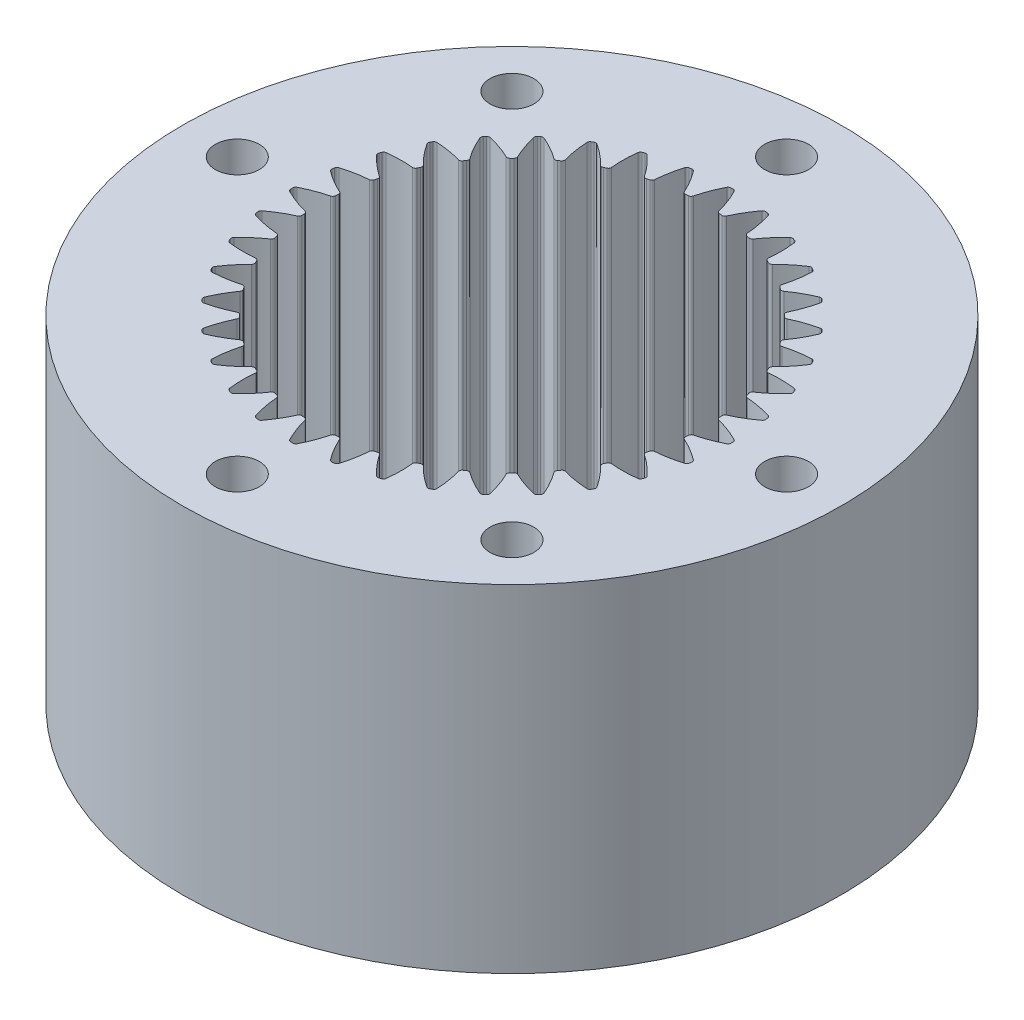
from build123d import *

# Parameters (mm, degrees)
SKETCH2_R            = 22.5
BOSS_EXTRUDE1_DEPTH  = 23
SKETCH3_R            = 13.15
CUT_EXTRUDE1_DEPTH   = 30
CUT_EXTRUDE2_DEPTH   = 23
FILLET1_R            = 0.2
FILLET1_OF_MIRROR2_R = 0.2
CIRPATTERN6_DEPTH    = 23
SKETCH5_R            = 1.5
CUT_EXTRUDE3_DEPTH   = 34


# Read off the part's stored shape, not the designer's step: CirPattern6
with BuildPart() as part:
    # Sketch2 → Boss-Extrude1 (new body)
    with BuildSketch(Plane(origin=(0, 0, 0), x_dir=(1, 0, 0), z_dir=(0, 1, 0))):
        with Locations(Location((0, 0, 0), (0, 0, 270))):
            Circle(SKETCH2_R)
    extrude(amount=BOSS_EXTRUDE1_DEPTH)

    # Sketch3 → Cut-Extrude1 (cut)
    with BuildSketch(Plane(origin=(0, 23, 0), x_dir=(1, 0, 0), z_dir=(0, 1, 0))):
        with Locations(Location((0, 0, 0), (0, 0, 270))):
            Circle(SKETCH3_R)
    extrude(amount=-CUT_EXTRUDE1_DEPTH, mode=Mode.SUBTRACT)

    # Sketch4 → Cut-Extrude2 (cut)
    with BuildSketch(Plane(origin=(0, 23, 0), x_dir=(1, 0, 0), z_dir=(0, 1, 0))):
        with BuildLine():
            Line((0, 13.11), (0, 15.025))
            ThreePointArc((0, 15.025), (0.096895427, 15.02468756), (0.193786824, 15.023750253))
            ThreePointArc((0.193786824, 15.023750253), (0.621983825, 14.074691281), (0.921652068, 13.077563132))
            ThreePointArc((0.921652068, 13.077563132), (0.461111344, 13.101888273), (0, 13.11))
        make_face()
    cut_extrude2 = extrude(amount=-CUT_EXTRUDE2_DEPTH, mode=Mode.SUBTRACT)

    # Fillet1
    fillet1_edges = [part.edges().sort_by_distance(p)[0] for p in [
        (0.912166064, 11.5, -13.118325086),
        (0.193786824, 11.5, -15.023750253),
    ]]
    fillet(fillet1_edges, radius=FILLET1_R)

    # Mirror2: Cut-Extrude2 across plane
    add(cut_extrude2.mirror(Plane(origin=(0, 0, 0), x_dir=(0, 0, 1), z_dir=(1, 0, 0))), mode=Mode.SUBTRACT)

    # Fillet1 of Mirror2
    fillet1_of_mirror2_edges = [part.edges().sort_by_distance(p)[0] for p in [
        (-0.912166064, 11.5, -13.118325086),
        (-0.193786824, 11.5, -15.023750253),
    ]]
    fillet(fillet1_of_mirror2_edges, radius=FILLET1_OF_MIRROR2_R)

    # CirPattern6 outline → CirPattern6 (cut)
    with BuildSketch(Plane(origin=(0, 0, 0), x_dir=(1, 0, 0), z_dir=(0, 1, 0))):
        with BuildLine():
            ThreePointArc((-2.343895924, 14.73300193), (-2.429782385, 14.798153838), (-2.537010614, 14.809260689))
            ThreePointArc((-2.537010614, 14.809260689), (-2.60906387, 14.796736489), (-2.681055311, 14.783861722))
            ThreePointArc((-2.681055311, 14.783861722), (-2.77801812, 14.736750482), (-2.836441728, 14.646152815))
            ThreePointArc((-2.836441728, 14.646152815), (-3.050701384, 13.784201245), (-3.166852541, 12.903646524))
            ThreePointArc((-3.166852541, 12.903646524), (-3.212731829, 12.790475649), (-3.315860377, 12.725076423))
            ThreePointArc((-3.315860377, 12.725076423), (-2.283473536, 12.950221953), (-1.236342934, 13.091751455))
            ThreePointArc((-1.236342934, 13.091751455), (-1.355619922, 13.117934584), (-1.43743907, 13.20858878))
            ThreePointArc((-1.43743907, 13.20858878), (-1.847752907, 13.996313519), (-2.343895924, 14.73300193))
        make_face()
        with BuildLine():
            ThreePointArc((1.236342934, 13.091751455), (2.283473536, 12.950221953), (3.315860377, 12.725076423))
            ThreePointArc((3.315860377, 12.725076423), (3.212731829, 12.790475649), (3.166852541, 12.903646524))
            ThreePointArc((3.166852541, 12.903646524), (3.050701384, 13.784201245), (2.836441728, 14.646152815))
            ThreePointArc((2.836441728, 14.646152815), (2.77801812, 14.736750482), (2.681055311, 14.783861722))
            ThreePointArc((2.681055311, 14.783861722), (2.60906387, 14.796736489), (2.537010614, 14.809260689))
            ThreePointArc((2.537010614, 14.809260689), (2.429782385, 14.798153838), (2.343895924, 14.73300193))
            ThreePointArc((2.343895924, 14.73300193), (1.847752907, 13.996313519), (1.43743907, 13.20858878))
            ThreePointArc((1.43743907, 13.20858878), (1.355619922, 13.117934584), (1.236342934, 13.091751455))
        make_face()
        with BuildLine():
            ThreePointArc((3.49091889, 12.678169636), (4.497564885, 12.356957964), (5.475171338, 11.955960807))
            ThreePointArc((5.475171338, 11.955960807), (5.384966001, 12.038274556), (5.359435639, 12.157692966))
            ThreePointArc((5.359435639, 12.157692966), (5.397955802, 13.045039519), (5.336627551, 13.931101907))
            ThreePointArc((5.336627551, 13.931101907), (5.294823648, 14.030468345), (5.207514703, 14.093701275))
            ThreePointArc((5.207514703, 14.093701275), (5.138852653, 14.118881627), (5.070068853, 14.143727473))
            ThreePointArc((5.070068853, 14.143727473), (4.962540977, 14.151409347), (4.866645815, 14.10216127))
            ThreePointArc((4.866645815, 14.10216127), (4.250115725, 13.462819142), (3.709248512, 12.758311962))
            ThreePointArc((3.709248512, 12.758311962), (3.612930445, 12.683242753), (3.49091889, 12.678169636))
        make_face()
        with BuildLine():
            ThreePointArc((5.639425041, 11.879368048), (6.575, 11.38823406), (7.468121989, 10.823569373))
            ThreePointArc((7.468121989, 10.823569373), (7.393580707, 10.920296583), (7.389174997, 11.04233406))
            ThreePointArc((7.389174997, 11.04233406), (7.581196065, 11.909510869), (7.674662646, 12.792761517))
            ThreePointArc((7.674662646, 12.792761517), (7.65074864, 12.897877527), (7.575746396, 12.975310845))
            ThreePointArc((7.575746396, 12.975310845), (7.5125, 13.012031692), (7.449075616, 13.048444255))
            ThreePointArc((7.449075616, 13.048444255), (7.344515273, 13.074681444), (7.241525135, 13.042833576))
            ThreePointArc((7.241525135, 13.042833576), (6.523340927, 12.520263818), (5.868354314, 11.920380291))
            ThreePointArc((5.868354314, 11.920380291), (5.760463904, 11.863177008), (5.639425041, 11.879368048))
        make_face()
        with BuildLine():
            ThreePointArc((7.616580117, 10.719617873), (8.452657068, 10.073484427), (9.234157533, 9.362309259))
            ThreePointArc((9.234157533, 9.362309259), (9.177545204, 9.470510924), (9.194398012, 9.591459421))
            ThreePointArc((9.194398012, 9.591459421), (9.534085521, 10.412117758), (9.779507001, 11.265719542))
            ThreePointArc((9.779507001, 11.265719542), (9.774209505, 11.373391227), (9.713792869, 11.462672162))
            ThreePointArc((9.713792869, 11.462672162), (9.657883836, 11.509817758), (9.601745986, 11.556690661))
            ThreePointArc((9.601745986, 11.556690661), (9.50333019, 11.600685961), (9.396374379, 11.587205983))
            ThreePointArc((9.396374379, 11.587205983), (8.598357717, 11.197286613), (7.849153141, 10.720253897))
            ThreePointArc((7.849153141, 10.720253897), (7.732968583, 10.682654634), (7.616580117, 10.719617873))
        make_face()
        with BuildLine():
            ThreePointArc((9.362309259, 9.234157533), (10.073484427, 8.452657068), (10.719617873, 7.616580117))
            ThreePointArc((10.719617873, 7.616580117), (10.682654634, 7.732968583), (10.720253897, 7.849153141))
            ThreePointArc((10.720253897, 7.849153141), (11.197286613, 8.598357717), (11.587205983, 9.396374379))
            ThreePointArc((11.587205983, 9.396374379), (11.600685961, 9.50333019), (11.556690661, 9.601745986))
            ThreePointArc((11.556690661, 9.601745986), (11.509817758, 9.657883836), (11.462672162, 9.713792869))
            ThreePointArc((11.462672162, 9.713792869), (11.373391227, 9.774209505), (11.265719542, 9.779507001))
            ThreePointArc((11.265719542, 9.779507001), (10.412117758, 9.534085521), (9.591459421, 9.194398012))
            ThreePointArc((9.591459421, 9.194398012), (9.470510924, 9.177545204), (9.362309259, 9.234157533))
        make_face()
        with BuildLine():
            ThreePointArc((10.823569373, 7.468121989), (11.38823406, 6.575), (11.879368048, 5.639425041))
            ThreePointArc((11.879368048, 5.639425041), (11.863177008, 5.760463904), (11.920380291, 5.868354314))
            ThreePointArc((11.920380291, 5.868354314), (12.520263818, 6.523340927), (13.042833576, 7.241525135))
            ThreePointArc((13.042833576, 7.241525135), (13.074681444, 7.344515273), (13.048444255, 7.449075616))
            ThreePointArc((13.048444255, 7.449075616), (13.012031692, 7.5125), (12.975310845, 7.575746396))
            ThreePointArc((12.975310845, 7.575746396), (12.897877527, 7.65074864), (12.792761517, 7.674662646))
            ThreePointArc((12.792761517, 7.674662646), (11.909510869, 7.581196065), (11.04233406, 7.389174997))
            ThreePointArc((11.04233406, 7.389174997), (10.920296583, 7.393580707), (10.823569373, 7.468121989))
        make_face()
        with BuildLine():
            ThreePointArc((11.955960807, 5.475171338), (12.356957964, 4.497564885), (12.678169636, 3.49091889))
            ThreePointArc((12.678169636, 3.49091889), (12.683242753, 3.612930445), (12.758311962, 3.709248512))
            ThreePointArc((12.758311962, 3.709248512), (13.462819142, 4.250115725), (14.10216127, 4.866645815))
            ThreePointArc((14.10216127, 4.866645815), (14.151409347, 4.962540977), (14.143727473, 5.070068853))
            ThreePointArc((14.143727473, 5.070068853), (14.118881627, 5.138852653), (14.093701275, 5.207514703))
            ThreePointArc((14.093701275, 5.207514703), (14.030468345, 5.294823648), (13.931101907, 5.336627551))
            ThreePointArc((13.931101907, 5.336627551), (13.045039519, 5.397955802), (12.157692966, 5.359435639))
            ThreePointArc((12.157692966, 5.359435639), (12.038274556, 5.384966001), (11.955960807, 5.475171338))
        make_face()
        with BuildLine():
            ThreePointArc((12.725076423, 3.315860377), (12.950221952, 2.283473536), (13.091751455, 1.236342934))
            ThreePointArc((13.091751455, 1.236342934), (13.117934584, 1.355619922), (13.20858878, 1.43743907))
            ThreePointArc((13.20858878, 1.43743907), (13.996313519, 1.847752907), (14.73300193, 2.343895924))
            ThreePointArc((14.73300193, 2.343895924), (14.798153838, 2.429782385), (14.809260689, 2.537010614))
            ThreePointArc((14.809260689, 2.537010614), (14.796736489, 2.60906387), (14.783861722, 2.681055311))
            ThreePointArc((14.783861722, 2.681055311), (14.736750482, 2.77801812), (14.646152815, 2.836441728))
            ThreePointArc((14.646152815, 2.836441728), (13.784201245, 3.050701384), (12.903646524, 3.166852541))
            ThreePointArc((12.903646524, 3.166852541), (12.790475649, 3.212731829), (12.725076423, 3.315860377))
        make_face()
        with BuildLine():
            ThreePointArc((13.107547031, 1.055798675), (13.15, 0), (13.107547031, -1.055798675))
            ThreePointArc((13.107547031, -1.055798675), (13.154044611, -0.942880426), (13.257529312, -0.878046231))
            ThreePointArc((13.257529312, -0.878046231), (14.104536992, -0.610752948), (14.916187782, -0.250072058))
            ThreePointArc((14.916187782, -0.250072058), (14.995263913, -0.176803916), (15.024822012, -0.073133409))
            ThreePointArc((15.024822012, -0.073133409), (15.025, 0), (15.024822012, 0.073133409))
            ThreePointArc((15.024822012, 0.073133409), (14.995263913, 0.176803916), (14.916187782, 0.250072058))
            ThreePointArc((14.916187782, 0.250072058), (14.104536992, 0.610752948), (13.257529312, 0.878046231))
            ThreePointArc((13.257529312, 0.878046231), (13.154044611, 0.942880426), (13.107547031, 1.055798675))
        make_face()
        with BuildLine():
            ThreePointArc((13.091751455, -1.236342934), (12.950221952, -2.283473536), (12.725076423, -3.315860377))
            ThreePointArc((12.725076423, -3.315860377), (12.790475649, -3.212731829), (12.903646524, -3.166852541))
            ThreePointArc((12.903646524, -3.166852541), (13.784201245, -3.050701384), (14.646152815, -2.836441728))
            ThreePointArc((14.646152815, -2.836441728), (14.736750482, -2.77801812), (14.783861722, -2.681055311))
            ThreePointArc((14.783861722, -2.681055311), (14.796736489, -2.60906387), (14.809260689, -2.537010614))
            ThreePointArc((14.809260689, -2.537010614), (14.798153838, -2.429782385), (14.73300193, -2.343895924))
            ThreePointArc((14.73300193, -2.343895924), (13.996313519, -1.847752907), (13.20858878, -1.43743907))
            ThreePointArc((13.20858878, -1.43743907), (13.117934584, -1.355619922), (13.091751455, -1.236342934))
        make_face()
        with BuildLine():
            ThreePointArc((12.678169636, -3.49091889), (12.356957963, -4.497564885), (11.955960807, -5.475171338))
            ThreePointArc((11.955960807, -5.475171338), (12.038274556, -5.384966001), (12.157692966, -5.359435639))
            ThreePointArc((12.157692966, -5.359435639), (13.045039519, -5.397955802), (13.931101907, -5.336627551))
            ThreePointArc((13.931101907, -5.336627551), (14.030468345, -5.294823648), (14.093701275, -5.207514703))
            ThreePointArc((14.093701275, -5.207514703), (14.118881627, -5.138852653), (14.143727473, -5.070068853))
            ThreePointArc((14.143727473, -5.070068853), (14.151409347, -4.962540977), (14.10216127, -4.866645815))
            ThreePointArc((14.10216127, -4.866645815), (13.462819142, -4.250115725), (12.758311962, -3.709248512))
            ThreePointArc((12.758311962, -3.709248512), (12.683242753, -3.612930445), (12.678169636, -3.49091889))
        make_face()
        with BuildLine():
            ThreePointArc((11.879368047, -5.639425041), (11.38823406, -6.575), (10.823569372, -7.468121989))
            ThreePointArc((10.823569372, -7.468121989), (10.920296583, -7.393580707), (11.04233406, -7.389174997))
            ThreePointArc((11.04233406, -7.389174997), (11.909510869, -7.581196065), (12.792761517, -7.674662646))
            ThreePointArc((12.792761517, -7.674662646), (12.897877527, -7.65074864), (12.975310845, -7.575746396))
            ThreePointArc((12.975310845, -7.575746396), (13.012031692, -7.5125), (13.048444255, -7.449075616))
            ThreePointArc((13.048444255, -7.449075616), (13.074681444, -7.344515273), (13.042833576, -7.241525135))
            ThreePointArc((13.042833576, -7.241525135), (12.520263818, -6.523340927), (11.920380291, -5.868354314))
            ThreePointArc((11.920380291, -5.868354314), (11.863177008, -5.760463904), (11.879368047, -5.639425041))
        make_face()
        with BuildLine():
            ThreePointArc((10.719617873, -7.616580116), (10.073484427, -8.452657067), (9.362309259, -9.234157533))
            ThreePointArc((9.362309259, -9.234157533), (9.470510924, -9.177545204), (9.591459421, -9.194398012))
            ThreePointArc((9.591459421, -9.194398012), (10.412117758, -9.534085521), (11.265719542, -9.779507001))
            ThreePointArc((11.265719542, -9.779507001), (11.373391227, -9.774209505), (11.462672162, -9.713792869))
            ThreePointArc((11.462672162, -9.713792869), (11.509817758, -9.657883836), (11.556690661, -9.601745986))
            ThreePointArc((11.556690661, -9.601745986), (11.600685961, -9.50333019), (11.587205983, -9.396374379))
            ThreePointArc((11.587205983, -9.396374379), (11.197286613, -8.598357717), (10.720253897, -7.849153141))
            ThreePointArc((10.720253897, -7.849153141), (10.682654634, -7.732968583), (10.719617873, -7.616580116))
        make_face()
        with BuildLine():
            ThreePointArc((9.234157533, -9.362309259), (8.452657067, -10.073484427), (7.616580116, -10.719617872))
            ThreePointArc((7.616580116, -10.719617872), (7.732968583, -10.682654634), (7.849153141, -10.720253897))
            ThreePointArc((7.849153141, -10.720253897), (8.598357717, -11.197286613), (9.396374379, -11.587205983))
            ThreePointArc((9.396374379, -11.587205983), (9.50333019, -11.600685961), (9.601745986, -11.556690661))
            ThreePointArc((9.601745986, -11.556690661), (9.657883836, -11.509817758), (9.713792869, -11.462672162))
            ThreePointArc((9.713792869, -11.462672162), (9.774209505, -11.373391227), (9.779507001, -11.265719542))
            ThreePointArc((9.779507001, -11.265719542), (9.534085521, -10.412117758), (9.194398012, -9.591459421))
            ThreePointArc((9.194398012, -9.591459421), (9.177545204, -9.470510924), (9.234157533, -9.362309259))
        make_face()
        with BuildLine():
            ThreePointArc((7.468121989, -10.823569372), (6.575, -11.38823406), (5.639425041, -11.879368047))
            ThreePointArc((5.639425041, -11.879368047), (5.760463904, -11.863177008), (5.868354314, -11.920380291))
            ThreePointArc((5.868354314, -11.920380291), (6.523340927, -12.520263818), (7.241525135, -13.042833576))
            ThreePointArc((7.241525135, -13.042833576), (7.344515273, -13.074681444), (7.449075616, -13.048444255))
            ThreePointArc((7.449075616, -13.048444255), (7.5125, -13.012031692), (7.575746396, -12.975310845))
            ThreePointArc((7.575746396, -12.975310845), (7.65074864, -12.897877527), (7.674662646, -12.792761517))
            ThreePointArc((7.674662646, -12.792761517), (7.581196065, -11.909510869), (7.389174997, -11.04233406))
            ThreePointArc((7.389174997, -11.04233406), (7.393580707, -10.920296583), (7.468121989, -10.823569372))
        make_face()
        with BuildLine():
            ThreePointArc((5.475171338, -11.955960807), (4.497564885, -12.356957963), (3.49091889, -12.678169635))
            ThreePointArc((3.49091889, -12.678169635), (3.612930445, -12.683242753), (3.709248512, -12.758311962))
            ThreePointArc((3.709248512, -12.758311962), (4.250115725, -13.462819142), (4.866645815, -14.10216127))
            ThreePointArc((4.866645815, -14.10216127), (4.962540977, -14.151409347), (5.070068853, -14.143727473))
            ThreePointArc((5.070068853, -14.143727473), (5.138852653, -14.118881627), (5.207514703, -14.093701275))
            ThreePointArc((5.207514703, -14.093701275), (5.294823648, -14.030468345), (5.336627551, -13.931101907))
            ThreePointArc((5.336627551, -13.931101907), (5.397955802, -13.045039519), (5.359435639, -12.157692966))
            ThreePointArc((5.359435639, -12.157692966), (5.384966001, -12.038274556), (5.475171338, -11.955960807))
        make_face()
        with BuildLine():
            ThreePointArc((3.315860377, -12.725076423), (2.283473536, -12.950221952), (1.236342934, -13.091751455))
            ThreePointArc((1.236342934, -13.091751455), (1.355619922, -13.117934584), (1.43743907, -13.20858878))
            ThreePointArc((1.43743907, -13.20858878), (1.847752907, -13.996313519), (2.343895924, -14.73300193))
            ThreePointArc((2.343895924, -14.73300193), (2.429782385, -14.798153838), (2.537010614, -14.809260689))
            ThreePointArc((2.537010614, -14.809260689), (2.60906387, -14.796736489), (2.681055311, -14.783861722))
            ThreePointArc((2.681055311, -14.783861722), (2.77801812, -14.736750482), (2.836441728, -14.646152815))
            ThreePointArc((2.836441728, -14.646152815), (3.050701384, -13.784201245), (3.166852541, -12.903646524))
            ThreePointArc((3.166852541, -12.903646524), (3.212731829, -12.790475649), (3.315860377, -12.725076423))
        make_face()
        with BuildLine():
            ThreePointArc((1.055798675, -13.107547031), (0, -13.15), (-1.055798675, -13.107547031))
            ThreePointArc((-1.055798675, -13.107547031), (-0.942880426, -13.154044611), (-0.878046231, -13.257529312))
            ThreePointArc((-0.878046231, -13.257529312), (-0.610752948, -14.104536992), (-0.250072058, -14.916187782))
            ThreePointArc((-0.250072058, -14.916187782), (-0.176803916, -14.995263913), (-0.073133409, -15.024822012))
            ThreePointArc((-0.073133409, -15.024822012), (0, -15.025), (0.073133409, -15.024822012))
            ThreePointArc((0.073133409, -15.024822012), (0.176803916, -14.995263913), (0.250072058, -14.916187782))
            ThreePointArc((0.250072058, -14.916187782), (0.610752948, -14.104536992), (0.878046231, -13.257529312))
            ThreePointArc((0.878046231, -13.257529312), (0.942880426, -13.154044611), (1.055798675, -13.107547031))
        make_face()
        with BuildLine():
            ThreePointArc((-1.236342934, -13.091751455), (-2.283473536, -12.950221952), (-3.315860377, -12.725076423))
            ThreePointArc((-3.315860377, -12.725076423), (-3.212731829, -12.790475649), (-3.166852541, -12.903646524))
            ThreePointArc((-3.166852541, -12.903646524), (-3.050701384, -13.784201245), (-2.836441728, -14.646152815))
            ThreePointArc((-2.836441728, -14.646152815), (-2.77801812, -14.736750482), (-2.681055311, -14.783861722))
            ThreePointArc((-2.681055311, -14.783861722), (-2.60906387, -14.796736489), (-2.537010614, -14.809260689))
            ThreePointArc((-2.537010614, -14.809260689), (-2.429782385, -14.798153838), (-2.343895924, -14.73300193))
            ThreePointArc((-2.343895924, -14.73300193), (-1.847752907, -13.996313519), (-1.43743907, -13.20858878))
            ThreePointArc((-1.43743907, -13.20858878), (-1.355619922, -13.117934584), (-1.236342934, -13.091751455))
        make_face()
        with BuildLine():
            ThreePointArc((-3.49091889, -12.678169635), (-4.497564885, -12.356957963), (-5.475171338, -11.955960807))
            ThreePointArc((-5.475171338, -11.955960807), (-5.384966001, -12.038274556), (-5.359435639, -12.157692966))
            ThreePointArc((-5.359435639, -12.157692966), (-5.397955802, -13.045039519), (-5.336627551, -13.931101907))
            ThreePointArc((-5.336627551, -13.931101907), (-5.294823648, -14.030468345), (-5.207514703, -14.093701275))
            ThreePointArc((-5.207514703, -14.093701275), (-5.138852653, -14.118881627), (-5.070068853, -14.143727473))
            ThreePointArc((-5.070068853, -14.143727473), (-4.962540977, -14.151409347), (-4.866645815, -14.10216127))
            ThreePointArc((-4.866645815, -14.10216127), (-4.250115725, -13.462819142), (-3.709248512, -12.758311962))
            ThreePointArc((-3.709248512, -12.758311962), (-3.612930445, -12.683242753), (-3.49091889, -12.678169635))
        make_face()
        with BuildLine():
            ThreePointArc((-5.639425041, -11.879368047), (-6.575, -11.38823406), (-7.468121989, -10.823569372))
            ThreePointArc((-7.468121989, -10.823569372), (-7.393580707, -10.920296583), (-7.389174997, -11.04233406))
            ThreePointArc((-7.389174997, -11.04233406), (-7.581196065, -11.909510869), (-7.674662646, -12.792761517))
            ThreePointArc((-7.674662646, -12.792761517), (-7.65074864, -12.897877527), (-7.575746396, -12.975310845))
            ThreePointArc((-7.575746396, -12.975310845), (-7.5125, -13.012031692), (-7.449075616, -13.048444255))
            ThreePointArc((-7.449075616, -13.048444255), (-7.344515273, -13.074681444), (-7.241525135, -13.042833576))
            ThreePointArc((-7.241525135, -13.042833576), (-6.523340927, -12.520263818), (-5.868354314, -11.920380291))
            ThreePointArc((-5.868354314, -11.920380291), (-5.760463904, -11.863177008), (-5.639425041, -11.879368047))
        make_face()
        with BuildLine():
            ThreePointArc((-7.616580116, -10.719617872), (-8.452657067, -10.073484427), (-9.234157533, -9.362309259))
            ThreePointArc((-9.234157533, -9.362309259), (-9.177545204, -9.470510924), (-9.194398012, -9.591459421))
            ThreePointArc((-9.194398012, -9.591459421), (-9.534085521, -10.412117758), (-9.779507001, -11.265719542))
            ThreePointArc((-9.779507001, -11.265719542), (-9.774209505, -11.373391227), (-9.713792869, -11.462672162))
            ThreePointArc((-9.713792869, -11.462672162), (-9.657883836, -11.509817758), (-9.601745986, -11.556690661))
            ThreePointArc((-9.601745986, -11.556690661), (-9.50333019, -11.600685961), (-9.396374379, -11.587205983))
            ThreePointArc((-9.396374379, -11.587205983), (-8.598357717, -11.197286613), (-7.849153141, -10.720253897))
            ThreePointArc((-7.849153141, -10.720253897), (-7.732968583, -10.682654634), (-7.616580116, -10.719617872))
        make_face()
        with BuildLine():
            ThreePointArc((-9.362309259, -9.234157533), (-10.073484427, -8.452657067), (-10.719617873, -7.616580116))
            ThreePointArc((-10.719617873, -7.616580116), (-10.682654634, -7.732968583), (-10.720253897, -7.849153141))
            ThreePointArc((-10.720253897, -7.849153141), (-11.197286613, -8.598357717), (-11.587205983, -9.396374379))
            ThreePointArc((-11.587205983, -9.396374379), (-11.600685961, -9.50333019), (-11.556690661, -9.601745986))
            ThreePointArc((-11.556690661, -9.601745986), (-11.509817758, -9.657883836), (-11.462672162, -9.713792869))
            ThreePointArc((-11.462672162, -9.713792869), (-11.373391227, -9.774209505), (-11.265719542, -9.779507001))
            ThreePointArc((-11.265719542, -9.779507001), (-10.412117758, -9.534085521), (-9.591459421, -9.194398012))
            ThreePointArc((-9.591459421, -9.194398012), (-9.470510924, -9.177545204), (-9.362309259, -9.234157533))
        make_face()
        with BuildLine():
            ThreePointArc((-10.823569372, -7.468121989), (-11.38823406, -6.575), (-11.879368047, -5.639425041))
            ThreePointArc((-11.879368047, -5.639425041), (-11.863177008, -5.760463904), (-11.920380291, -5.868354314))
            ThreePointArc((-11.920380291, -5.868354314), (-12.520263818, -6.523340927), (-13.042833576, -7.241525135))
            ThreePointArc((-13.042833576, -7.241525135), (-13.074681444, -7.344515273), (-13.048444255, -7.449075616))
            ThreePointArc((-13.048444255, -7.449075616), (-13.012031692, -7.5125), (-12.975310845, -7.575746396))
            ThreePointArc((-12.975310845, -7.575746396), (-12.897877527, -7.65074864), (-12.792761517, -7.674662646))
            ThreePointArc((-12.792761517, -7.674662646), (-11.909510869, -7.581196065), (-11.04233406, -7.389174997))
            ThreePointArc((-11.04233406, -7.389174997), (-10.920296583, -7.393580707), (-10.823569372, -7.468121989))
        make_face()
        with BuildLine():
            ThreePointArc((-11.955960807, -5.475171338), (-12.356957963, -4.497564885), (-12.678169636, -3.49091889))
            ThreePointArc((-12.678169636, -3.49091889), (-12.683242753, -3.612930445), (-12.758311962, -3.709248512))
            ThreePointArc((-12.758311962, -3.709248512), (-13.462819142, -4.250115725), (-14.10216127, -4.866645815))
            ThreePointArc((-14.10216127, -4.866645815), (-14.151409347, -4.962540977), (-14.143727473, -5.070068853))
            ThreePointArc((-14.143727473, -5.070068853), (-14.118881627, -5.138852653), (-14.093701275, -5.207514703))
            ThreePointArc((-14.093701275, -5.207514703), (-14.030468345, -5.294823648), (-13.931101907, -5.336627551))
            ThreePointArc((-13.931101907, -5.336627551), (-13.045039519, -5.397955802), (-12.157692966, -5.359435639))
            ThreePointArc((-12.157692966, -5.359435639), (-12.038274556, -5.384966001), (-11.955960807, -5.475171338))
        make_face()
        with BuildLine():
            ThreePointArc((-12.725076423, -3.315860377), (-12.950221952, -2.283473536), (-13.091751455, -1.236342934))
            ThreePointArc((-13.091751455, -1.236342934), (-13.117934584, -1.355619922), (-13.20858878, -1.43743907))
            ThreePointArc((-13.20858878, -1.43743907), (-13.996313519, -1.847752907), (-14.73300193, -2.343895924))
            ThreePointArc((-14.73300193, -2.343895924), (-14.798153838, -2.429782385), (-14.809260689, -2.537010614))
            ThreePointArc((-14.809260689, -2.537010614), (-14.796736489, -2.60906387), (-14.783861722, -2.681055311))
            ThreePointArc((-14.783861722, -2.681055311), (-14.736750482, -2.77801812), (-14.646152815, -2.836441728))
            ThreePointArc((-14.646152815, -2.836441728), (-13.784201245, -3.050701384), (-12.903646524, -3.166852541))
            ThreePointArc((-12.903646524, -3.166852541), (-12.790475649, -3.212731829), (-12.725076423, -3.315860377))
        make_face()
        with BuildLine():
            ThreePointArc((-13.107547031, -1.055798675), (-13.15, 0), (-13.107547031, 1.055798675))
            ThreePointArc((-13.107547031, 1.055798675), (-13.154044611, 0.942880426), (-13.257529312, 0.878046231))
            ThreePointArc((-13.257529312, 0.878046231), (-14.104536992, 0.610752948), (-14.916187782, 0.250072058))
            ThreePointArc((-14.916187782, 0.250072058), (-14.995263913, 0.176803916), (-15.024822012, 0.073133409))
            ThreePointArc((-15.024822012, 0.073133409), (-15.025, 0), (-15.024822012, -0.073133409))
            ThreePointArc((-15.024822012, -0.073133409), (-14.995263913, -0.176803916), (-14.916187782, -0.250072058))
            ThreePointArc((-14.916187782, -0.250072058), (-14.104536992, -0.610752948), (-13.257529312, -0.878046231))
            ThreePointArc((-13.257529312, -0.878046231), (-13.154044611, -0.942880426), (-13.107547031, -1.055798675))
        make_face()
        with BuildLine():
            ThreePointArc((-13.091751455, 1.236342934), (-12.950221952, 2.283473536), (-12.725076423, 3.315860377))
            ThreePointArc((-12.725076423, 3.315860377), (-12.790475649, 3.212731829), (-12.903646524, 3.166852541))
            ThreePointArc((-12.903646524, 3.166852541), (-13.784201245, 3.050701384), (-14.646152815, 2.836441728))
            ThreePointArc((-14.646152815, 2.836441728), (-14.736750482, 2.77801812), (-14.783861722, 2.681055311))
            ThreePointArc((-14.783861722, 2.681055311), (-14.796736489, 2.60906387), (-14.809260689, 2.537010614))
            ThreePointArc((-14.809260689, 2.537010614), (-14.798153838, 2.429782385), (-14.73300193, 2.343895924))
            ThreePointArc((-14.73300193, 2.343895924), (-13.996313519, 1.847752907), (-13.20858878, 1.43743907))
            ThreePointArc((-13.20858878, 1.43743907), (-13.117934584, 1.355619922), (-13.091751455, 1.236342934))
        make_face()
        with BuildLine():
            ThreePointArc((-12.678169636, 3.49091889), (-12.356957964, 4.497564885), (-11.955960807, 5.475171338))
            ThreePointArc((-11.955960807, 5.475171338), (-12.038274556, 5.384966001), (-12.157692966, 5.359435639))
            ThreePointArc((-12.157692966, 5.359435639), (-13.045039519, 5.397955802), (-13.931101907, 5.336627551))
            ThreePointArc((-13.931101907, 5.336627551), (-14.030468345, 5.294823648), (-14.093701275, 5.207514703))
            ThreePointArc((-14.093701275, 5.207514703), (-14.118881627, 5.138852653), (-14.143727473, 5.070068853))
            ThreePointArc((-14.143727473, 5.070068853), (-14.151409347, 4.962540977), (-14.10216127, 4.866645815))
            ThreePointArc((-14.10216127, 4.866645815), (-13.462819142, 4.250115725), (-12.758311962, 3.709248512))
            ThreePointArc((-12.758311962, 3.709248512), (-12.683242753, 3.612930445), (-12.678169636, 3.49091889))
        make_face()
        with BuildLine():
            ThreePointArc((-11.879368048, 5.639425041), (-11.38823406, 6.575), (-10.823569373, 7.468121989))
            ThreePointArc((-10.823569373, 7.468121989), (-10.920296583, 7.393580707), (-11.04233406, 7.389174997))
            ThreePointArc((-11.04233406, 7.389174997), (-11.909510869, 7.581196065), (-12.792761517, 7.674662646))
            ThreePointArc((-12.792761517, 7.674662646), (-12.897877527, 7.65074864), (-12.975310845, 7.575746396))
            ThreePointArc((-12.975310845, 7.575746396), (-13.012031692, 7.5125), (-13.048444255, 7.449075616))
            ThreePointArc((-13.048444255, 7.449075616), (-13.074681444, 7.344515273), (-13.042833576, 7.241525135))
            ThreePointArc((-13.042833576, 7.241525135), (-12.520263818, 6.523340927), (-11.920380291, 5.868354314))
            ThreePointArc((-11.920380291, 5.868354314), (-11.863177008, 5.760463904), (-11.879368048, 5.639425041))
        make_face()
        with BuildLine():
            ThreePointArc((-10.719617873, 7.616580117), (-10.073484427, 8.452657068), (-9.362309259, 9.234157533))
            ThreePointArc((-9.362309259, 9.234157533), (-9.470510924, 9.177545204), (-9.591459421, 9.194398012))
            ThreePointArc((-9.591459421, 9.194398012), (-10.412117758, 9.534085521), (-11.265719542, 9.779507001))
            ThreePointArc((-11.265719542, 9.779507001), (-11.373391227, 9.774209505), (-11.462672162, 9.713792869))
            ThreePointArc((-11.462672162, 9.713792869), (-11.509817758, 9.657883836), (-11.556690661, 9.601745986))
            ThreePointArc((-11.556690661, 9.601745986), (-11.600685961, 9.50333019), (-11.587205983, 9.396374379))
            ThreePointArc((-11.587205983, 9.396374379), (-11.197286613, 8.598357717), (-10.720253897, 7.849153141))
            ThreePointArc((-10.720253897, 7.849153141), (-10.682654634, 7.732968583), (-10.719617873, 7.616580117))
        make_face()
        with BuildLine():
            ThreePointArc((-9.234157533, 9.362309259), (-8.452657068, 10.073484427), (-7.616580117, 10.719617873))
            ThreePointArc((-7.616580117, 10.719617873), (-7.732968583, 10.682654634), (-7.849153141, 10.720253897))
            ThreePointArc((-7.849153141, 10.720253897), (-8.598357717, 11.197286613), (-9.396374379, 11.587205983))
            ThreePointArc((-9.396374379, 11.587205983), (-9.50333019, 11.600685961), (-9.601745986, 11.556690661))
            ThreePointArc((-9.601745986, 11.556690661), (-9.657883836, 11.509817758), (-9.713792869, 11.462672162))
            ThreePointArc((-9.713792869, 11.462672162), (-9.774209505, 11.373391227), (-9.779507001, 11.265719542))
            ThreePointArc((-9.779507001, 11.265719542), (-9.534085521, 10.412117758), (-9.194398012, 9.591459421))
            ThreePointArc((-9.194398012, 9.591459421), (-9.177545204, 9.470510924), (-9.234157533, 9.362309259))
        make_face()
        with BuildLine():
            ThreePointArc((-7.468121989, 10.823569373), (-6.575, 11.38823406), (-5.639425041, 11.879368048))
            ThreePointArc((-5.639425041, 11.879368048), (-5.760463904, 11.863177008), (-5.868354314, 11.920380291))
            ThreePointArc((-5.868354314, 11.920380291), (-6.523340927, 12.520263818), (-7.241525135, 13.042833576))
            ThreePointArc((-7.241525135, 13.042833576), (-7.344515273, 13.074681444), (-7.449075616, 13.048444255))
            ThreePointArc((-7.449075616, 13.048444255), (-7.5125, 13.012031692), (-7.575746396, 12.975310845))
            ThreePointArc((-7.575746396, 12.975310845), (-7.65074864, 12.897877527), (-7.674662646, 12.792761517))
            ThreePointArc((-7.674662646, 12.792761517), (-7.581196065, 11.909510869), (-7.389174997, 11.04233406))
            ThreePointArc((-7.389174997, 11.04233406), (-7.393580707, 10.920296583), (-7.468121989, 10.823569373))
        make_face()
        with BuildLine():
            ThreePointArc((-5.475171338, 11.955960807), (-4.497564885, 12.356957964), (-3.49091889, 12.678169636))
            ThreePointArc((-3.49091889, 12.678169636), (-3.612930445, 12.683242753), (-3.709248512, 12.758311962))
            ThreePointArc((-3.709248512, 12.758311962), (-4.250115725, 13.462819142), (-4.866645815, 14.10216127))
            ThreePointArc((-4.866645815, 14.10216127), (-4.962540977, 14.151409347), (-5.070068853, 14.143727473))
            ThreePointArc((-5.070068853, 14.143727473), (-5.138852653, 14.118881627), (-5.207514703, 14.093701275))
            ThreePointArc((-5.207514703, 14.093701275), (-5.294823648, 14.030468345), (-5.336627551, 13.931101907))
            ThreePointArc((-5.336627551, 13.931101907), (-5.397955802, 13.045039519), (-5.359435639, 12.157692966))
            ThreePointArc((-5.359435639, 12.157692966), (-5.384966001, 12.038274556), (-5.475171338, 11.955960807))
        make_face()
    extrude(amount=CIRPATTERN6_DEPTH, mode=Mode.SUBTRACT)

    # Sketch5 → Cut-Extrude3 (cut)
    with BuildSketch(Plane(origin=(0, 23, 0), x_dir=(1, 0, 0), z_dir=(0, 1, 0))):
        with Locations(Location((0, 18.75, 0), (0, 0, 270))):
            Circle(SKETCH5_R)
        with Locations(Location((-18.75, 0, 0), (0, 0, 270))):
            Circle(SKETCH5_R)
        with Locations(Location((0, -18.75, 0), (0, 0, 270))):
            Circle(SKETCH5_R)
        with Locations(Location((18.75, 0, 0), (0, 0, 270))):
            Circle(SKETCH5_R)
        with Locations(Location((-13.258252147, 13.258252147, 0), (0, 0, 270))):
            Circle(SKETCH5_R)
        with Locations(Location((13.258252147, -13.258252147, 0), (0, 0, 270))):
            Circle(SKETCH5_R)
    extrude(amount=-CUT_EXTRUDE3_DEPTH, mode=Mode.SUBTRACT)


solid = part.part
